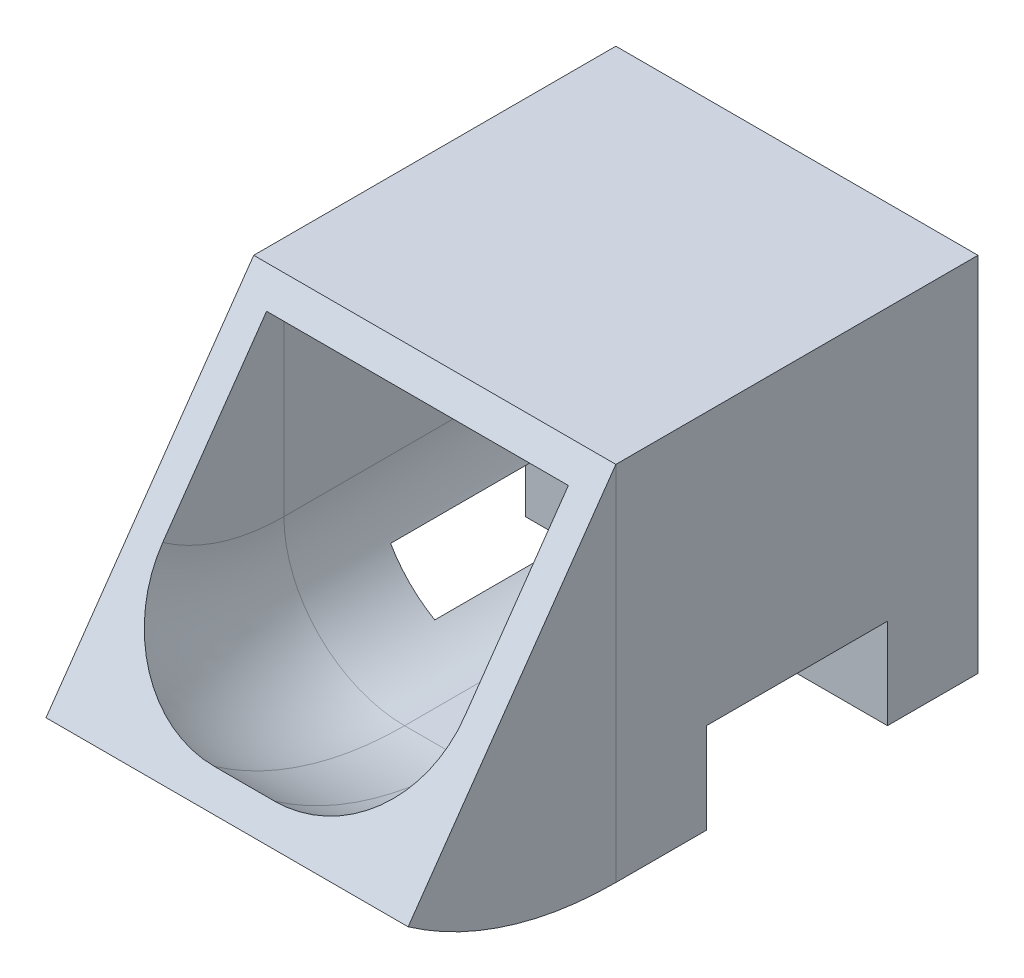
from build123d import *

# Parameters (mm, degrees)
ESQUISSE1_W             = 60
ESQUISSE1_H             = 60
ESQUISSE1_W_2           = 50
ESQUISSE1_H_2           = 50
BOSS_EXTRU_3_DEPTH      = 60
ESQUISSE10_W            = 60
ESQUISSE10_H            = 60
ESQUISSE10_W_2          = 50
ESQUISSE10_H_2          = 50
R_VOLUTION1_ANGLE       = 35
ESQUISSE11_W            = 30
ESQUISSE11_H            = 15
ENL_V_MAT_EXTRU_3_DEPTH = 15
ESQUISSE12_W            = 30
ESQUISSE12_H            = 15
ENL_V_MAT_EXTRU_4_DEPTH = 15
CONG_1_DEPTH            = 15
CONG_1_START            = 45
CONG_1_2_DEPTH          = 15
CONG_1_START_2          = 15
CONG_1_3_DEPTH          = 30
CONG_3_R                = 20
CONG_4_R                = 20
CONG_5_DEPTH            = 15
CONG_5_START            = 45
CONG_5_2_DEPTH          = 15
CONG_5_START_2          = 15
CONG_5_3_DEPTH          = 30


with BuildPart() as part:
    # Esquisse1 → Boss.-Extru.3 (new body)
    with BuildSketch(Plane.XY):
        with Locations((30, 30)):
            Rectangle(ESQUISSE1_W, ESQUISSE1_H)
        with Locations((30, 30)):
            Rectangle(ESQUISSE1_W_2, ESQUISSE1_H_2, mode=Mode.SUBTRACT)
    extrude(amount=BOSS_EXTRU_3_DEPTH)

    # Esquisse11 → Enlèv. mat.-Extru.3 (cut)
    with BuildSketch(Plane.ZY):
        with Locations((30, 7.5)):
            Rectangle(ESQUISSE11_W, ESQUISSE11_H)
    extrude(amount=-ENL_V_MAT_EXTRU_3_DEPTH, mode=Mode.SUBTRACT)

    # Esquisse12 → Enlèv. mat.-Extru.4 (cut)
    with BuildSketch(Plane(origin=(60, 0, 0), x_dir=(0, 0, -1), z_dir=(1, 0, 0))):
        with Locations((-30, 7.5)):
            Rectangle(ESQUISSE12_W, ESQUISSE12_H)
    extrude(amount=-ENL_V_MAT_EXTRU_4_DEPTH, mode=Mode.SUBTRACT)

    # Congé1: read off the stored shape, not the designer's step
    # Congé1 outline → Congé1 (add)
    with BuildSketch(Plane.XY):
        with BuildLine():
            Line((55, 5), (55, 25))
            ThreePointArc((55, 25), (49.142135624, 10.857864376), (35, 5))
            Line((35, 5), (55, 5))
        make_face()
    extrude(amount=CONG_1_DEPTH)

    # Cong_1 2 outline → Cong_1 2 (add)
    with BuildSketch(Plane.XY.offset(CONG_1_START)):
        with BuildLine():
            Line((55, 5), (55, 25))
            ThreePointArc((55, 25), (49.142135624, 10.857864376), (35, 5))
            Line((35, 5), (55, 5))
        make_face()
    extrude(amount=CONG_1_2_DEPTH)

    # Cong_1 3 outline → Cong_1 3 (add)
    with BuildSketch(Plane.XY.offset(CONG_1_START_2)):
        with BuildLine():
            Line((52.320508076, 15), (55, 15))
            Line((55, 15), (55, 25))
            ThreePointArc((55, 25), (54.318516526, 19.823619098), (52.320508076, 15))
        make_face()
        with BuildLine():
            Line((45, 5), (45, 7.679491924))
            ThreePointArc((45, 7.679491924), (40.176380902, 5.681483474), (35, 5))
            Line((35, 5), (45, 5))
        make_face()
    extrude(amount=CONG_1_3_DEPTH)

    # Congé5: read off the stored shape, not the designer's step
    # Congé5 outline → Congé5 (add)
    with BuildSketch(Plane.XY):
        with BuildLine():
            Line((5, 25), (5, 5))
            Line((5, 5), (25, 5))
            ThreePointArc((25, 5), (10.857864376, 10.857864376), (5, 25))
        make_face()
    extrude(amount=CONG_5_DEPTH)

    # Cong_5 2 outline → Cong_5 2 (add)
    with BuildSketch(Plane.XY.offset(CONG_5_START)):
        with BuildLine():
            Line((5, 25), (5, 5))
            Line((5, 5), (25, 5))
            ThreePointArc((25, 5), (10.857864376, 10.857864376), (5, 25))
        make_face()
    extrude(amount=CONG_5_2_DEPTH)

    # Cong_5 3 outline → Cong_5 3 (add)
    with BuildSketch(Plane.XY.offset(CONG_5_START_2)):
        with BuildLine():
            Line((5, 15), (7.679491924, 15))
            ThreePointArc((7.679491924, 15), (5.681483474, 19.823619098), (5, 25))
            Line((5, 25), (5, 15))
        make_face()
        with BuildLine():
            ThreePointArc((25, 5), (19.823619098, 5.681483474), (15, 7.679491924))
            Line((15, 7.679491924), (15, 5))
            Line((15, 5), (25, 5))
        make_face()
    extrude(amount=CONG_5_3_DEPTH)


with BuildPart() as body_2:
    # Esquisse10 → Révolution1 (revolve)
    with BuildSketch(Plane.XY.offset(60)):
        with Locations((30, 30)):
            Rectangle(ESQUISSE10_W, ESQUISSE10_H)
        with Locations((30, 30)):
            Rectangle(ESQUISSE10_W_2, ESQUISSE10_H_2, mode=Mode.SUBTRACT)
    revolve(axis=Axis((0, 60, 60), (-1, 0, 0)), revolution_arc=R_VOLUTION1_ANGLE)

    # Congé3
    cong_3_edges = [body_2.edges().sort_by_distance(p)[0] for p in [
        (5, 7.545567709, 76.538818973),
    ]]
    fillet(cong_3_edges, radius=CONG_3_R)

    # Congé4
    cong_4_edges = [body_2.edges().sort_by_distance(p)[0] for p in [
        (55, 7.545567709, 76.538818973),
    ]]
    fillet(cong_4_edges, radius=CONG_4_R)


solid = Compound([part.part, body_2.part])
